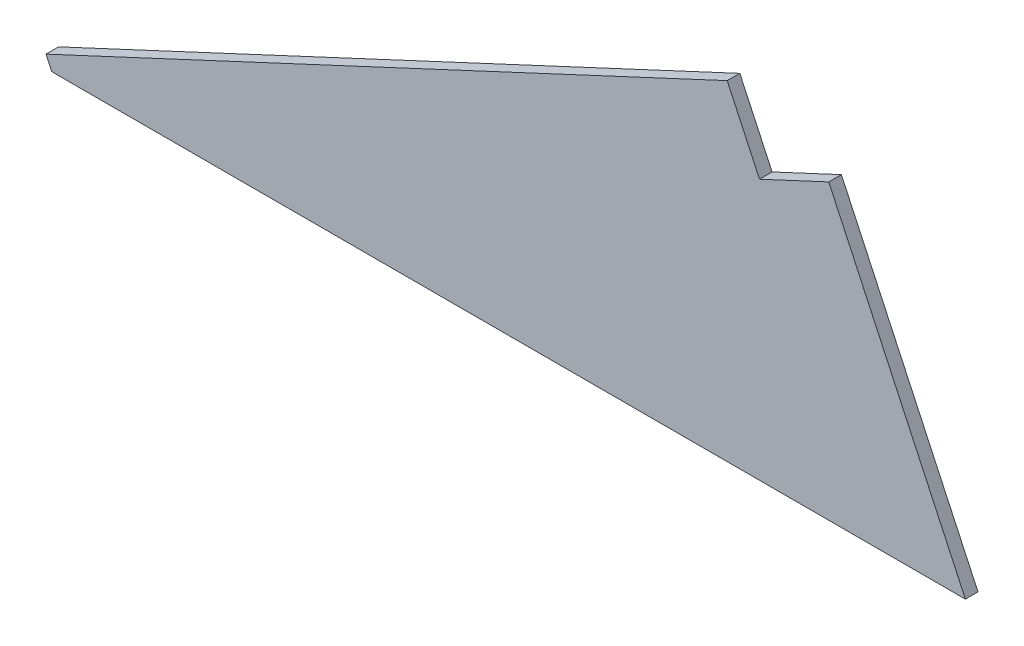
from build123d import *

# Parameters (mm, degrees)
BOSS_EXTRUDE1_DEPTH = 3.3


with BuildPart() as part:
    # Sketch1 → Boss-Extrude1 (new body)
    with BuildSketch(Plane.XY):
        Polygon((321.546211226, 12.634626077), (82.3833171, 12.634626077), (80.878144987, 15.862477964), (259.198908878, 99.014815774), (267.651274112, 80.888660034), (285.777429853, 89.341025269), align=None)
    extrude(amount=-BOSS_EXTRUDE1_DEPTH)


solid = part.part
